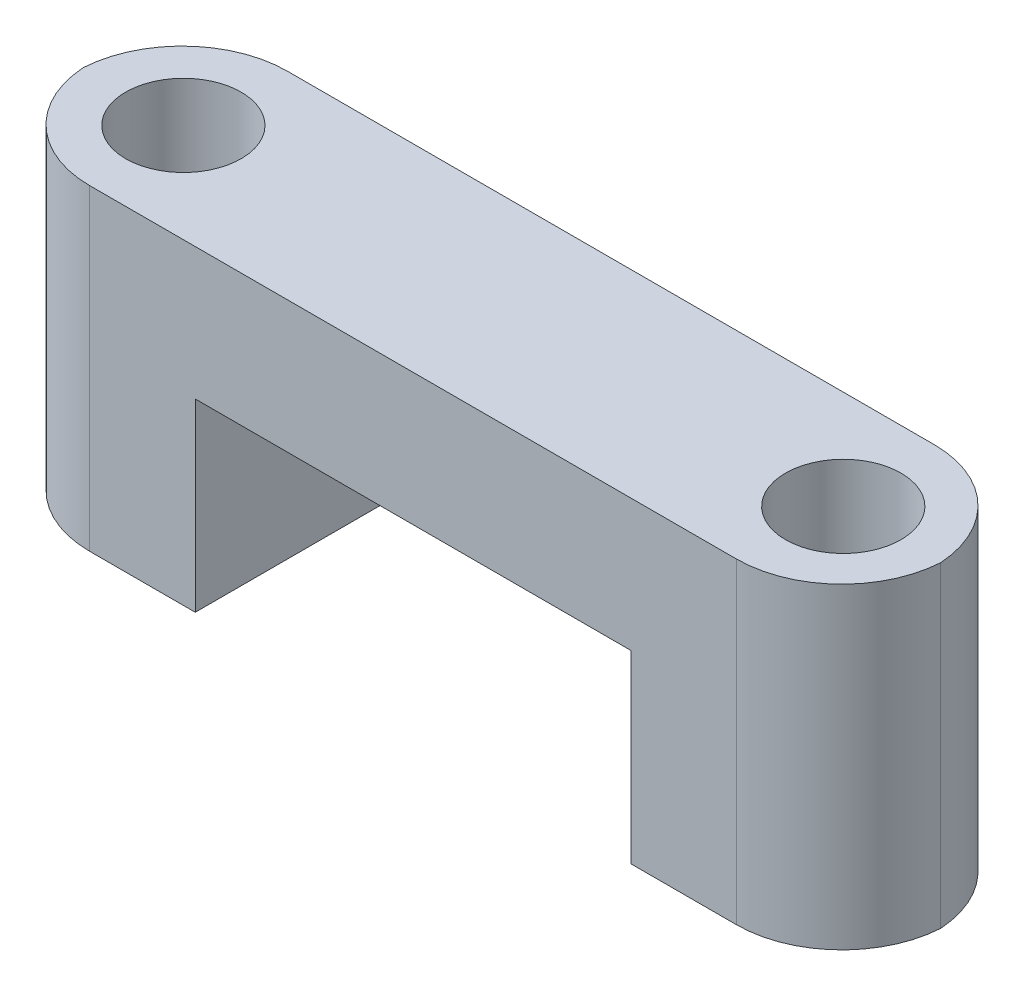
from build123d import *

# Parameters (mm, degrees)
SKETCH1_W                       = 41.275
SKETCH1_H                       = 9.525
BOSS_EXTRUDE1_DEPTH             = 6.35
SKETCH2_W                       = 10.16
SKETCH2_H                       = 9.525
BOSS_EXTRUDE2_DEPTH             = 8.89
F_7_32_0_21875_DIAMETER_HOLE1_D = 5.55625
FILLET1_R                       = 5.08


with BuildPart() as part:
    # Sketch1 → Boss-Extrude1 (new body)
    with BuildSketch(Plane(origin=(0, 0, 0), x_dir=(1, 0, 0), z_dir=(0, 1, 0))):
        Rectangle(SKETCH1_W, SKETCH1_H)
    extrude(amount=BOSS_EXTRUDE1_DEPTH)

    # Sketch2 → Boss-Extrude2 (add)
    with BuildSketch(Plane.XZ):
        with Locations((-15.5575, 0)):
            Rectangle(SKETCH2_W, SKETCH2_H)
        with Locations((15.5575, 0)):
            Rectangle(SKETCH2_W, SKETCH2_H)
    extrude(amount=BOSS_EXTRUDE2_DEPTH)

    # 7/32 (0.21875) Diameter Hole1 (through all)
    with Locations(Plane(origin=(0, 6.35, 0), x_dir=(1, 0, 0), z_dir=(0, 1, 0))):
        with Locations((-15.8115, 0), (15.9385, 0)):
            Hole(F_7_32_0_21875_DIAMETER_HOLE1_D / 2)

    # Fillet1
    # the kernel refuses this fillet: 5.08 mm, written as the material it takes off along each edge
    with BuildSketch(Plane(origin=(20.6375, -21.59, -4.7625), x_dir=(0, 0, 1), z_dir=(0, 1, 0)), Plane(origin=(20.6375, -21.59, 4.7625), x_dir=(-1, 0, 0), z_dir=(0, 1, 0)), Plane(origin=(-20.6375, 19.05, -4.7625), x_dir=(0, 0, 1), z_dir=(0, -1, 0)), Plane(origin=(-20.6375, 19.05, 4.7625), x_dir=(1, 0, 0), z_dir=(0, -1, 0))) as fillet1_piece_1:
        with BuildLine():
            CenterArc((FILLET1_R, -FILLET1_R), FILLET1_R, 90, 90)
            Line((0, -FILLET1_R), (0, 0))
            Line((0, 0), (FILLET1_R, 0))
        make_face()
    extrude(amount=40.64, mode=Mode.SUBTRACT)


solid = part.part
